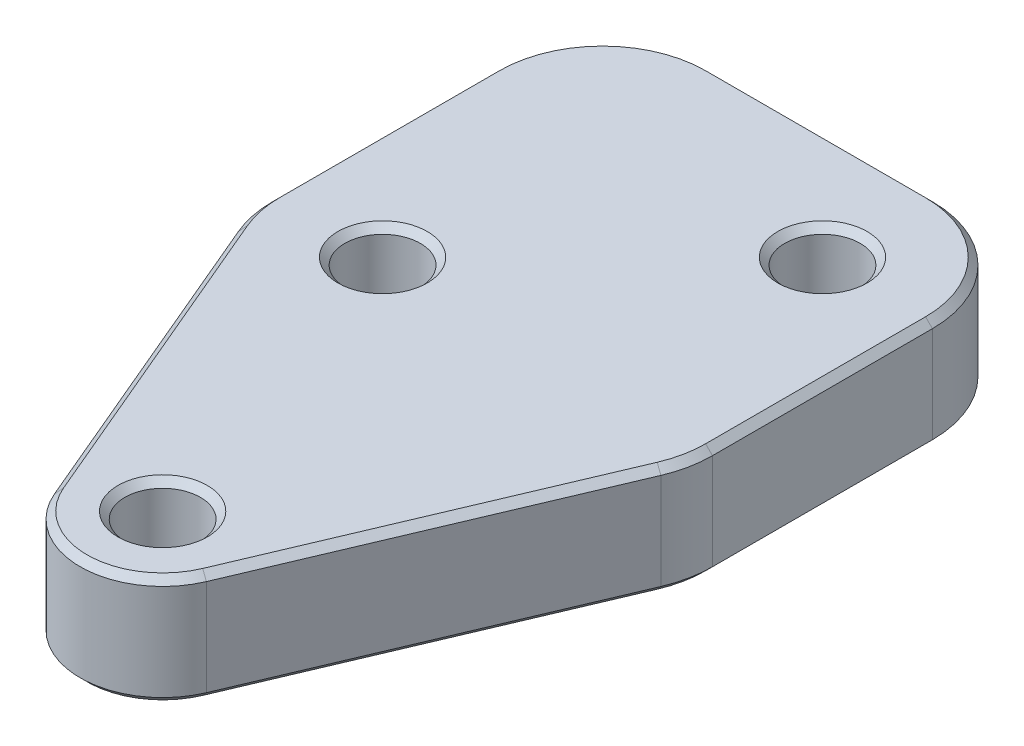
from build123d import *

# Parameters (mm, degrees)
SKETCH1_R           = 2.1828125
BOSS_EXTRUDE1_DEPTH = 6.35
CHAMFER1_SIZE       = 0.396875


with BuildPart() as part:
    # Sketch1 → Boss-Extrude1 (new body)
    with BuildSketch(Plane(origin=(0, 0, 0), x_dir=(1, 0, 0), z_dir=(0, 1, 0))):
        with BuildLine():
            Line((-12.7, 19.05), (-12.7, 31.75))
            ThreePointArc((-12.7, 31.75), (-10.840128061, 36.240128061), (-6.35, 38.1))
            Line((-6.35, 38.1), (6.35, 38.1))
            ThreePointArc((6.35, 38.1), (10.840128061, 36.240128061), (12.7, 31.75))
            Line((12.7, 31.75), (12.7, 19.05))
            ThreePointArc((12.7, 19.05), (12.572860713, 17.785680204), (12.196534001, 16.571988666))
            Line((12.196534001, 16.571988666), (4.384900501, -1.8585085))
            ThreePointArc((4.384900501, -1.8585085), (0, -4.7625), (-4.384900501, -1.8585085))
            Line((-4.384900501, -1.8585085), (-12.196534001, 16.571988666))
            ThreePointArc((-12.196534001, 16.571988666), (-12.572860713, 17.785680204), (-12.7, 19.05))
        make_face()
        Circle(SKETCH1_R, mode=Mode.SUBTRACT)
        with Locations((6.35, 31.75)):
            Circle(SKETCH1_R, mode=Mode.SUBTRACT)
        with Locations((-6.35, 19.05)):
            Circle(SKETCH1_R, mode=Mode.SUBTRACT)
    extrude(amount=BOSS_EXTRUDE1_DEPTH)

    # Chamfer1
    chamfer1_edges = [part.edges().sort_by_distance(p)[0] for p in [
        (-8.5328125, 0, -19.05),
        (4.1671875, 0, -31.75),
        (-2.1828125, 0, 0),
        (12.7, 0, -25.4),
        (10.840128061, 0, -36.240128061),
        (0, 0, -38.1),
        (-10.840128061, 0, -36.240128061),
        (-12.7, 0, -25.4),
        (-12.572860713, 0, -17.785680204),
        (-8.290717251, 0, -7.356740083),
        (0, 0, 4.7625),
        (8.290717251, 0, -7.356740083),
        (12.572860713, 0, -17.785680204),
        (-8.5328125, 6.35, -19.05),
        (-2.1828125, 6.35, 0),
        (8.290717251, 6.35, -7.356740083),
        (0, 6.35, 4.7625),
        (-8.290717251, 6.35, -7.356740083),
        (-12.572860713, 6.35, -17.785680204),
        (-12.7, 6.35, -25.4),
        (-10.840128061, 6.35, -36.240128061),
        (0, 6.35, -38.1),
        (10.840128061, 6.35, -36.240128061),
        (12.7, 6.35, -25.4),
        (12.572860713, 6.35, -17.785680204),
        (4.1671875, 6.35, -31.75),
    ]]
    chamfer(chamfer1_edges, length=CHAMFER1_SIZE)


solid = part.part
